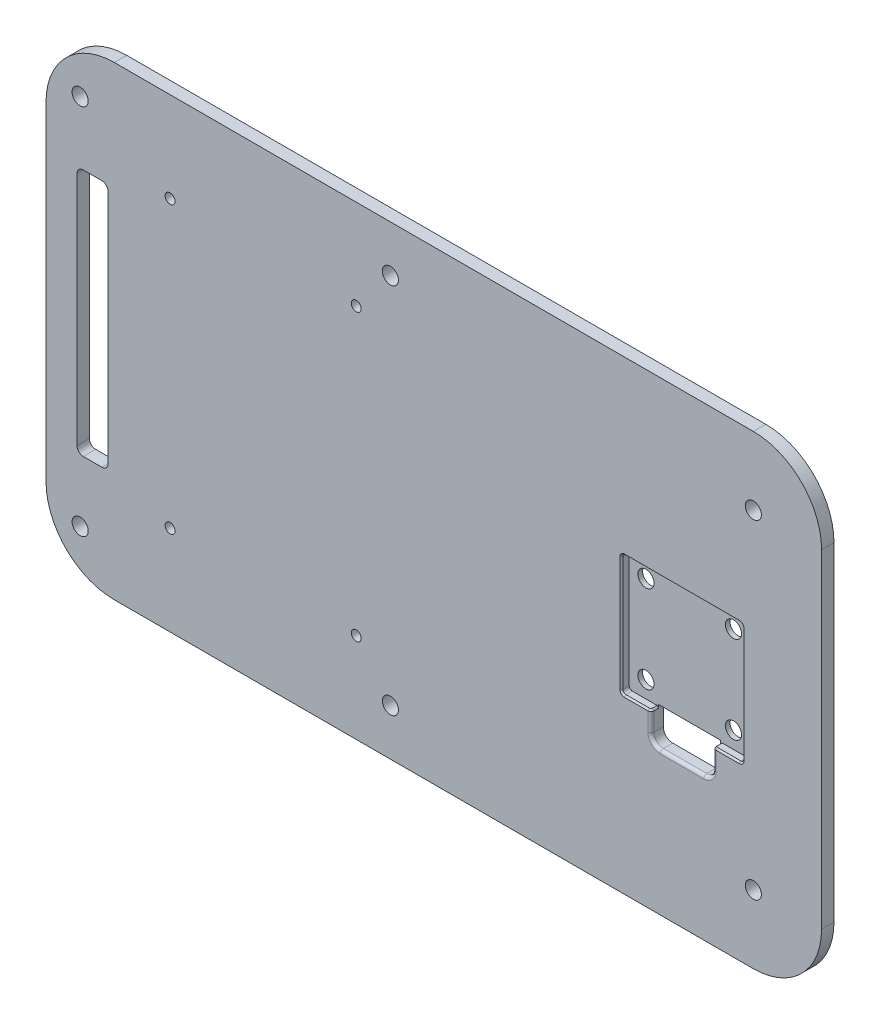
from build123d import *

# Parameters (mm, degrees)
SKETCH_1_R          = 2.6
SKETCH_1_R_2        = 1.6
SKETCH_1_W          = 20
SKETCH_1_H          = 10
EXTRUDE_1_DEPTH     = 4
SKETCH_2_W          = 39
SKETCH_2_H          = 39
CUT_EXTRUDE_1_DEPTH = 2.5
FILLET_1_R          = 3
FILLET_2_R          = 1
CHAMFER_1_SIZE      = 0.5
SKETCH_4_R          = 2.6
CUT_EXTRUDE_2_DEPTH = 2


with BuildPart() as part:
    # 草图1 → 凸台-拉伸1 (new body)
    with BuildSketch(Plane.XY):
        with BuildLine():
            Line((-103, -75), (103, -75))
            ThreePointArc((103, -75), (118.556349186, -68.556349186), (125, -53))
            Line((125, -53), (125, 53))
            ThreePointArc((125, 53), (118.556349186, 68.556349186), (103, 75))
            Line((103, 75), (-103, 75))
            ThreePointArc((-103, 75), (-118.556349186, 68.556349186), (-125, 53))
            Line((-125, 53), (-125, -53))
            ThreePointArc((-125, -53), (-118.556349186, -68.556349186), (-103, -75))
        make_face()
        with Locations((-114, 60)):
            Circle(SKETCH_1_R, mode=Mode.SUBTRACT)
        with Locations((-114, -60)):
            Circle(SKETCH_1_R, mode=Mode.SUBTRACT)
        with Locations((-14, -60)):
            Circle(SKETCH_1_R, mode=Mode.SUBTRACT)
        with Locations((-14, 60)):
            Circle(SKETCH_1_R, mode=Mode.SUBTRACT)
        with Locations((-85, 46)):
            Circle(SKETCH_1_R_2, mode=Mode.SUBTRACT)
        with Locations((-25, 46)):
            Circle(SKETCH_1_R_2, mode=Mode.SUBTRACT)
        with Locations((-25, -46)):
            Circle(SKETCH_1_R_2, mode=Mode.SUBTRACT)
        with Locations((-85, -46)):
            Circle(SKETCH_1_R_2, mode=Mode.SUBTRACT)
        with Locations((103, 53)):
            Circle(SKETCH_1_R, mode=Mode.SUBTRACT)
        with Locations((103, -53)):
            Circle(SKETCH_1_R, mode=Mode.SUBTRACT)
        with BuildLine():
            Line((-113, -40), (-107, -40))
            ThreePointArc((-107, -40), (-105.585786438, -39.414213562), (-105, -38))
            Line((-105, -38), (-105, 38))
            ThreePointArc((-105, 38), (-105.585786438, 39.414213562), (-107, 40))
            Line((-107, 40), (-113, 40))
            ThreePointArc((-113, 40), (-114.414213562, 39.414213562), (-115, 38))
            Line((-115, 38), (-115, -38))
            ThreePointArc((-115, -38), (-114.414213562, -39.414213562), (-113, -40))
        make_face(mode=Mode.SUBTRACT)
        with Locations((80, -24)):
            Rectangle(SKETCH_1_W, SKETCH_1_H, mode=Mode.SUBTRACT)
    extrude(amount=EXTRUDE_1_DEPTH)

    # 草图2 → 切除-拉伸1 (cut)
    with BuildSketch(Plane.XY.offset(4)):
        with Locations((80, 0)):
            Rectangle(SKETCH_2_W, SKETCH_2_H)
    extrude(amount=-CUT_EXTRUDE_1_DEPTH, mode=Mode.SUBTRACT)

    # 圆角1
    fillet_1_edges = [part.edges().sort_by_distance(p)[0] for p in [
        (70, -29, 2),
        (90, -29, 2),
    ]]
    fillet(fillet_1_edges, radius=FILLET_1_R)

    # 圆角2
    fillet_2_edges = [part.edges().sort_by_distance(p)[0] for p in [
        (80, -29, 4),
        (70.878679656, -28.121320344, 4),
        (70, -22.75, 4),
        (60.5, -19.5, 2.75),
        (99.5, -19.5, 2.75),
        (99.5, 19.5, 2.75),
        (60.5, 19.5, 2.75),
        (89.121320344, -28.121320344, 4),
        (90, -22.75, 4),
    ]]
    fillet(fillet_2_edges, radius=FILLET_2_R)

    # 倒角1
    chamfer_1_edges = [part.edges().sort_by_distance(p)[0] for p in [
        (60.792893219, -19.207106781, 4),
        (99.207106781, -19.207106781, 4),
        (99.5, 0, 4),
        (99.207106781, 19.207106781, 4),
        (80, 19.5, 4),
        (60.792893219, 19.207106781, 4),
        (60.5, 0, 4),
        (94.75, -19.5, 4),
        (90, -19.5, 2.25),
        (90.292893219, -19.5, 3.707106781),
    ]]
    chamfer(chamfer_1_edges, length=CHAMFER_1_SIZE)

    # 草图4 → 切除-拉伸2 (cut)
    with BuildSketch(Plane.XY.offset(1.5)):
        with Locations((65.900290783, -14.099709217)):
            Circle(SKETCH_4_R)
        with Locations((94.099709217, -14.099709217)):
            Circle(SKETCH_4_R)
        with Locations((94.099709217, 14.099709217)):
            Circle(SKETCH_4_R)
        with Locations((65.900290783, 14.099709217)):
            Circle(SKETCH_4_R)
    extrude(amount=-CUT_EXTRUDE_2_DEPTH, mode=Mode.SUBTRACT)


solid = part.part
